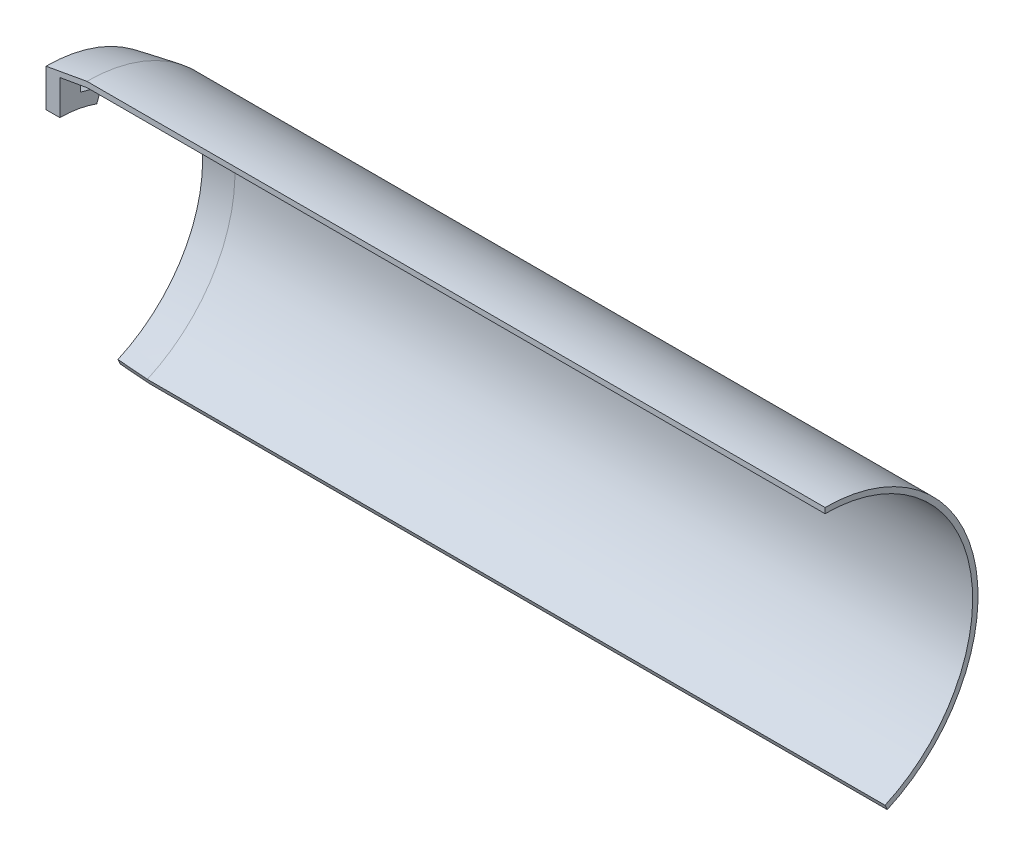
from build123d import *

# Parameters (mm, degrees)
REVOLVE5_ANGLE     = 156
REVOLVE6_ANGLE     = 20
REVOLVE7_ANGLE     = 50
SKETCH4_R          = 134.767451424
CUT_EXTRUDE2_DEPTH = 170
CUT_EXTRUDE3_DEPTH = 10


with BuildPart() as part:
    # Sketch1 → Revolve5 (revolve)
    with BuildSketch(Plane.XY):
        with BuildLine():
            Line((560, 85), (150, 85))
            add(Edge.make_bspline(
                [(135, 82.355324155), (136.665986153, 82.660220055), (140.530745222, 83.358357326), (145.198462089, 84.177415336), (148.333178957, 84.715838785), (149.39998937, 84.897876633), (149.733326587, 84.954653305), (149.933332963, 84.98866355), (150, 85)],
                knots=[0.919761031, 0.919761031, 0.919761031, 0.919761031, 0.946527454, 0.981827786, 0.994656092, 0.99679374, 0.998931275, 1, 1, 1, 1], degree=3))
            Line((135, 82.355324155), (135, 79.305358628))
            add(Edge.make_bspline(
                [(135, 79.305358628), (135.450261656, 79.387994183), (140.528235702, 80.316663108), (145.615370758, 81.210683778), (150.253322265, 82)],
                knots=[0.916860703, 0.916860703, 0.916860703, 0.916860703, 0.924115235, 0.99866409, 0.99866409, 0.99866409, 0.99866409], degree=3))
            Line((150.253322265, 82), (560, 82))
            Line((560, 82), (560, 85))
        make_face()
    revolve(axis=Axis((2.999985029, 0, 0), (-1, 0, 0)), revolution_arc=REVOLVE5_ANGLE)

    # Sketch1<8> → Revolve6 (revolve)
    with BuildSketch(Plane.XY):
        with BuildLine():
            add(Edge.make_bspline(
                [(127.3, 80.917055365), (127.333332995, 80.923411705), (129.432124967, 81.323524869), (131.998549763, 81.804337825), (134.533278004, 82.269908306), (135, 82.355324155)],
                knots=[0.878495962, 0.878495962, 0.878495962, 0.878495962, 0.879032247, 0.912262482, 0.919761031, 0.919761031, 0.919761031, 0.919761031], degree=3))
            Line((127.3, 80.917055365), (127.3, 60))
            Line((127.3, 60), (135, 60))
            Line((135, 60), (135, 82.355324155))
        make_face()
    revolve(axis=Axis((2.999985029, 0, 0), (-1, 0, 0)), revolution_arc=REVOLVE6_ANGLE)

    # Sketch1<9> → Revolve7 (revolve)
    with BuildSketch(Plane.XY):
        with BuildLine():
            Line((135, 79.305358628), (135, 82.355324155))
            add(Edge.make_bspline(
                [(127.3, 80.917055365), (127.333332995, 80.923411705), (129.432124967, 81.323524869), (131.998549763, 81.804337825), (134.533278004, 82.269908306), (135, 82.355324155)],
                knots=[0.878495962, 0.878495962, 0.878495962, 0.878495962, 0.879032247, 0.912262482, 0.919761031, 0.919761031, 0.919761031, 0.919761031], degree=3))
            Line((127.3, 80.917055365), (127.3, 77.862840189))
            add(Edge.make_bspline(
                [(127.3, 77.862840189), (127.616928493, 77.923460304), (128.38348221, 78.069699699), (129.150186585, 78.215050111), (129.599928532, 78.3)],
                knots=[0.875473599, 0.875473599, 0.875473599, 0.875473599, 0.88058804, 0.887842573, 0.887842573, 0.887842573, 0.887842573], degree=3))
            add(Edge.make_bspline(
                [(129.599928532, 78.3), (130.04967048, 78.384949889), (130.94927796, 78.554250366), (132.299119739, 78.806440107), (133.649347026, 79.056894297), (134.549738344, 79.222723073), (135, 79.305358628)],
                knots=[0.887842573, 0.887842573, 0.887842573, 0.887842573, 0.895097105, 0.902351638, 0.90960617, 0.916860703, 0.916860703, 0.916860703, 0.916860703], degree=3))
        make_face()
    revolve(axis=Axis((2.999985029, 0, 0), (-1, 0, 0)), revolution_arc=REVOLVE7_ANGLE)

    # Sketch4 → Cut-Extrude2 (cut)
    with BuildSketch(Plane.ZY.offset(-135)):
        with Locations((-34.572614661, -77.6513639)):
            Circle(SKETCH4_R)
    extrude(amount=CUT_EXTRUDE2_DEPTH, mode=Mode.SUBTRACT)

    # Sketch5 → Cut-Extrude3 (cut)
    with BuildSketch(Plane.ZY.offset(-127.3)):
        with BuildLine():
            Line((-25.651510749, 70.476946559), (-23.086359674, 63.429251903))
            Line((-23.086359674, 63.429251903), (-11.489863476, 66.514908384))
            Line((-11.489863476, 66.514908384), (-11.489863476, 74.114661419))
            ThreePointArc((-11.489863476, 74.114661419), (-18.659546141, 72.641732756), (-25.651510749, 70.476946559))
        make_face()
    extrude(amount=-CUT_EXTRUDE3_DEPTH, mode=Mode.SUBTRACT)


solid = part.part
